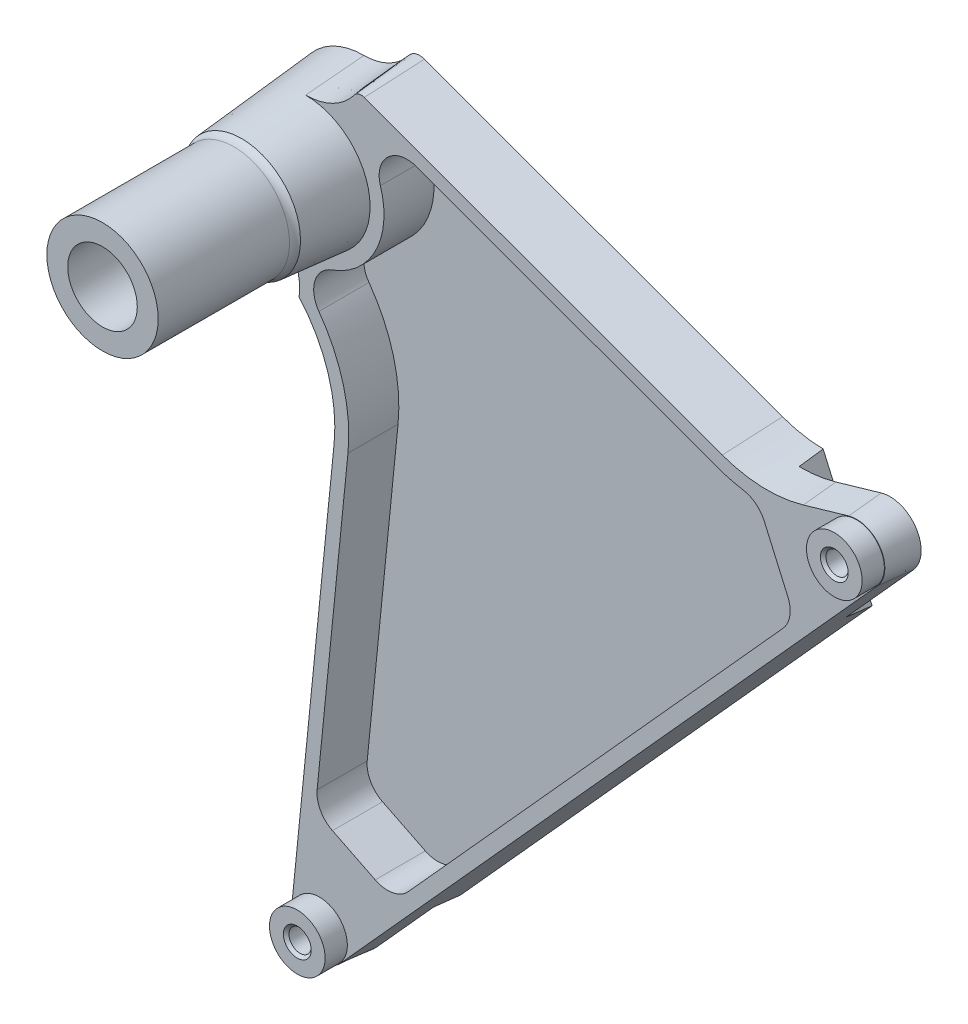
from build123d import *
from build123d.topology import SkipClean

# Parameters (mm, degrees)
EXTRUDE_741_DEPTH      = 21
EXTRUDE_741_TAPER      = 5
SKETCH_2_R             = 10
EXTRUDE_1024_DEPTH     = 8
CUT_EXTRUDE_1617_DEPTH = 9
SKETCH_4_R             = 23.162738066
EXTRUDE_1852_DEPTH     = 23
EXTRUDE_1852_TAPER     = 5
SKETCH_5_R             = 20
EXTRUDE_1938_DEPTH     = 50
FILLET_1977_R          = 4
SKETCH_6_R             = 12.5
CUT_EXTRUDE_2083_DEPTH = 24
SKETCH_7_R             = 10
CUT_EXTRUDE_2165_DEPTH = 330.802615362
FILLET_2203_R          = 0.3
SKETCH_8_R             = 4
CUT_EXTRUDE_2369_DEPTH = 329.777683375
CHAMFER_2404_SIZE      = 1
CUT_EXTRUDE_3109_DEPTH = 18


with BuildPart() as part:
    # Эскиз1 → Extrude 741 (new body)
    with BuildSketch(Plane.XY):
        with BuildLine():
            ThreePointArc((206.902825712, -28.037707575), (208.16042902, -13.627270923), (194.643197369, -8.47686326))
            Line((194.643197369, -8.47686326), (178.352602864, -13.211762774))
            ThreePointArc((178.352602864, -13.211762774), (164.281318134, -14.974601832), (150.3601632, -12.270882024))
            Line((150.3601632, -12.270882024), (21.714759937, 34.696764669))
            ThreePointArc((21.714759937, 34.696764669), (18.576858011, 34.793189635), (16, 33))
            ThreePointArc((16, 33), (8.94427191, 27.11145618), (0, 25))
            ThreePointArc((0, 25), (-24.017605322, 6.939354046), (-13.333333333, -21.147629234))
            ThreePointArc((-13.333333333, -21.147629234), (-5.735545873, -29.916516988), (-4.284649798, -41.428018512))
            ThreePointArc((-4.284649798, -41.428018512), (6.155658081, -59.36704661), (8.411759167, -80))
            Line((8.411759167, -80), (-6.939849245, -232.746575098))
            ThreePointArc((-6.939849245, -232.746575098), (0.139115456, -244.91798346), (13.910401615, -241.984282673))
            Line((13.910401615, -241.984282673), (206.902825712, -28.037707575))
        make_face()
    extrude(amount=EXTRUDE_741_DEPTH, taper=EXTRUDE_741_TAPER)

    # Эскиз2 → Extrude 1024 (add)
    with BuildSketch(Plane.XY.offset(21)):
        with Locations((5, -233.946575098)):
            Circle(SKETCH_2_R)
        with Locations((197.992424097, -20)):
            Circle(SKETCH_2_R)
    extrude(amount=EXTRUDE_1024_DEPTH)

    # Эскиз3 → Cut-Extrude 1617 (cut)
    with BuildSketch(Plane(origin=(0, 0, 0), x_dir=(-1, 0, 0), z_dir=(0, 0, -1))):
        with BuildLine():
            Line((-164.992424097, -14.992878037), (-182.581248366, -55))
            Line((-182.581248366, -55), (-206.902825712, -28.037707575))
            ThreePointArc((-206.902825712, -28.037707575), (-208.364208989, -13.964597929), (-195.406790483, -8.281873067))
            Line((-195.406790483, -8.281873067), (-164.992424097, -14.992878037))
        make_face()
        with BuildLine():
            Line((3.643325211, -199.946575098), (-34.691772051, -218.946575098))
            Line((-34.691772051, -218.946575098), (-13.910401615, -241.984282673))
            ThreePointArc((-13.910401615, -241.984282673), (-0.139115456, -244.91798346), (6.939849245, -232.746575098))
            Line((6.939849245, -232.746575098), (3.643325211, -199.946575098))
        make_face()
    extrude(amount=-CUT_EXTRUDE_1617_DEPTH, mode=Mode.SUBTRACT)

    # Эскиз4 → Extrude 1852 (add)
    with SkipClean():  # the faces are left unmerged after this step: merging them gives an invalid solid
        with BuildSketch(Plane.XY.offset(21)):
            Circle(SKETCH_4_R)
        extrude(amount=EXTRUDE_1852_DEPTH, taper=EXTRUDE_1852_TAPER)

    # Эскиз5 → Extrude 1938 (add)
    with SkipClean():  # the faces are left unmerged after this step: merging them gives an invalid solid
        with BuildSketch(Plane.XY.offset(44)):
            Circle(SKETCH_5_R)
        extrude(amount=EXTRUDE_1938_DEPTH)

    # Fillet 1977
    # the kernel refuses this fillet: 4 mm, written as the material it adds along each edge
    with BuildSketch(Plane(origin=(0, 0, 44), x_dir=(1, 0, 0), z_dir=(0, -1, 0))) as fillet_1977_piece_1:
        with BuildLine():
            CenterArc((24, 2.807194852), FILLET_1977_R, 180, 44.571493735)
            Line((20, 2.807194852), (19.92, 2.807194852))
            Line((19.92, 2.807194852), (19.92, 0))
            Line((19.92, 0), (20, -0.08))
            ThreePointArc((20, -0.08), (20.575249402, -0.08), (21.093508781, -0.056143897))
            Line((21.093508781, -0.056143897), (21.150498805, 0))
        make_face()
    revolve(axis=Axis((0, 0, 44), (0, 0, 1)))

    # Эскиз6 → Cut-Extrude 2083 (cut)
    with SkipClean():  # the faces are left unmerged after this step: merging them gives an invalid solid
        with BuildSketch(Plane.XY.offset(94)):
            Circle(SKETCH_6_R)
        extrude(amount=-CUT_EXTRUDE_2083_DEPTH, mode=Mode.SUBTRACT)

    # Эскиз7 → Cut-Extrude 2165 (cut, through all)
    with SkipClean():  # the faces are left unmerged after this step: merging them gives an invalid solid
        with BuildSketch(Plane.XY.offset(70)):
            Circle(SKETCH_7_R)
        extrude(amount=-CUT_EXTRUDE_2165_DEPTH, mode=Mode.SUBTRACT)

    # Fillet 2203
    fillet_2203_edges = [part.edges().sort_by_distance(p)[0] for p in [
        (-10, 0, 70),
    ]]
    fillet(fillet_2203_edges, radius=FILLET_2203_R)

    # Эскиз8 → Cut-Extrude 2369 (cut, through all)
    with SkipClean():  # the faces are left unmerged after this step: merging them gives an invalid solid
        with BuildSketch(Plane.XY.offset(29)):
            with Locations((197.992424097, -20)):
                Circle(SKETCH_8_R)
            with Locations((5, -233.946575098)):
                Circle(SKETCH_8_R)
        extrude(amount=-CUT_EXTRUDE_2369_DEPTH, mode=Mode.SUBTRACT)

    # Chamfer 2404
    chamfer_2404_edges = [part.edges().sort_by_distance(p)[0] for p in [
        (193.992424097, -20, 29),
        (1, -233.946575098, 29),
    ]]
    chamfer(chamfer_2404_edges, length=CHAMFER_2404_SIZE)

    # Эскиз11 → Cut-Extrude 3109 (cut)
    with SkipClean():  # the faces are left unmerged after this step: merging them gives an invalid solid
        with BuildSketch(Plane.XY.offset(21)):
            with BuildLine():
                Line((9.637769662, -200.948644603), (25.017172577, -208.571128339))
                ThreePointArc((25.017172577, -208.571128339), (31.330335402, -209.434392448), (36.883287498, -206.3093368))
                Line((36.883287498, -206.3093368), (171.559935828, -57.010172388))
                ThreePointArc((171.559935828, -57.010172388), (174.007077586, -51.904002649), (173.288958057, -46.287439952))
                Line((173.288958057, -46.287439952), (164.797960407, -26.974018349))
                ThreePointArc((164.797960407, -26.974018349), (161.780560792, -23.10323492), (157.284911476, -21.134275293))
                ThreePointArc((157.284911476, -21.134275293), (152.593572172, -20.128602218), (148.015310631, -18.693484081))
                Line((148.015310631, -18.693484081), (39.848510542, 20.797550357))
                ThreePointArc((39.848510542, 20.797550357), (29.514566508, 18.6378946), (26.875914748, 8.415760323))
                ThreePointArc((26.875914748, 8.415760323), (25.216951873, -12.539742964), (9.508763983, -26.50892723))
                ThreePointArc((9.508763983, -26.50892723), (3.334586222, -32.957378734), (4.772476125, -41.76847801))
                ThreePointArc((4.772476125, -41.76847801), (13.557685978, -60.269741059), (15.214748896, -80.683726193))
                Line((15.214748896, -80.683726193), (4.128675533, -190.988763419))
                ThreePointArc((4.128675533, -190.988763419), (5.327976017, -196.828955218), (9.637769662, -200.948644603))
            make_face()
        extrude(amount=-CUT_EXTRUDE_3109_DEPTH, mode=Mode.SUBTRACT)


solid = part.part
